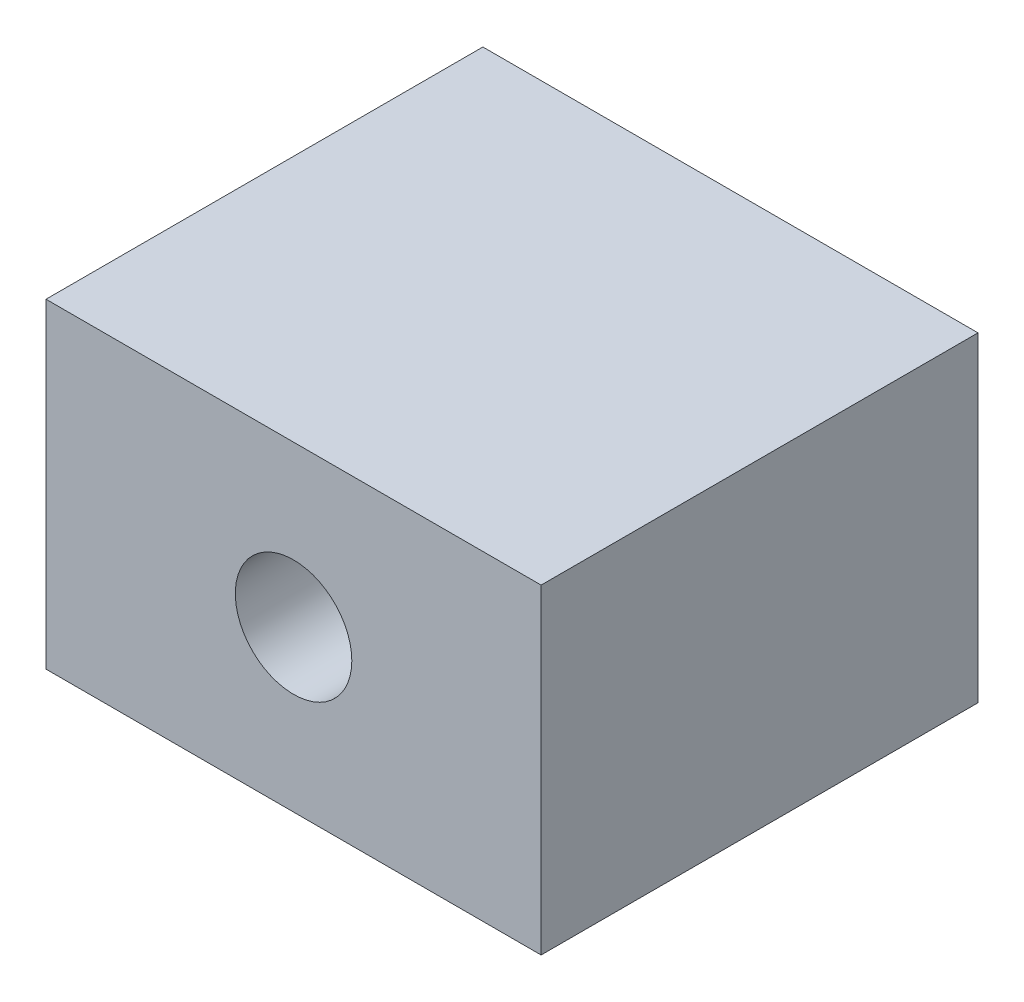
from build123d import *

# Parameters (mm, degrees)
SKETCH1_W           = 34
SKETCH1_H           = 22
SKETCH1_R           = 4
BOSS_EXTRUDE1_DEPTH = 30


with BuildPart() as part:
    # Sketch1 → Boss-Extrude1 (new body)
    with BuildSketch(Plane.XY):
        with Locations((17, 11)):
            Rectangle(SKETCH1_W, SKETCH1_H)
        with Locations((17, 11)):
            Circle(SKETCH1_R, mode=Mode.SUBTRACT)
    extrude(amount=BOSS_EXTRUDE1_DEPTH)


solid = part.part
